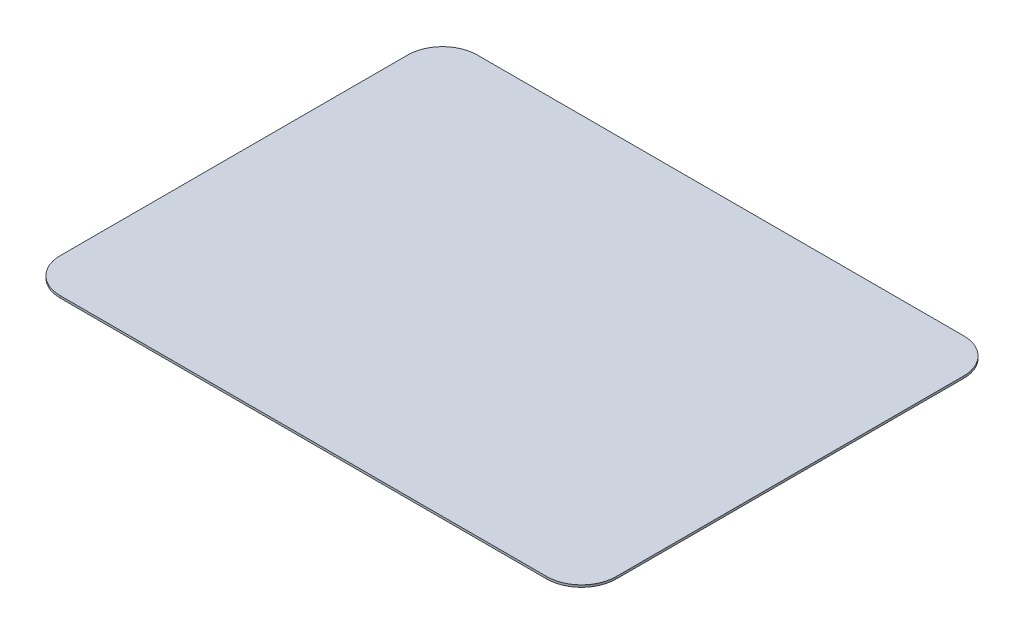
from build123d import *

# Parameters (mm, degrees)
MAINBODY_DEPTH = 0.79375


with BuildPart() as part:
    # Sketch1 → MainBody (new body)
    with BuildSketch(Plane(origin=(0, 25.019326354, 0), x_dir=(1, 0, 0), z_dir=(0, 1, 0))):
        with BuildLine():
            Line((98.380806561, -49.265564287), (98.380806561, 77.734435713))
            ThreePointArc((98.380806561, 77.734435713), (94.661062682, 86.714691834), (85.680806561, 90.434435713))
            Line((85.680806561, 90.434435713), (-92.119193439, 90.434435713))
            ThreePointArc((-92.119193439, 90.434435713), (-101.09944956, 86.714691834), (-104.819193439, 77.734435713))
            Line((-104.819193439, 77.734435713), (-104.819193439, -49.265564287))
            ThreePointArc((-104.819193439, -49.265564287), (-101.09944956, -58.245820408), (-92.119193439, -61.965564287))
            Line((-92.119193439, -61.965564287), (85.680806561, -61.965564287))
            ThreePointArc((85.680806561, -61.965564287), (94.661062682, -58.245820408), (98.380806561, -49.265564287))
        make_face()
    extrude(amount=MAINBODY_DEPTH)


solid = part.part
